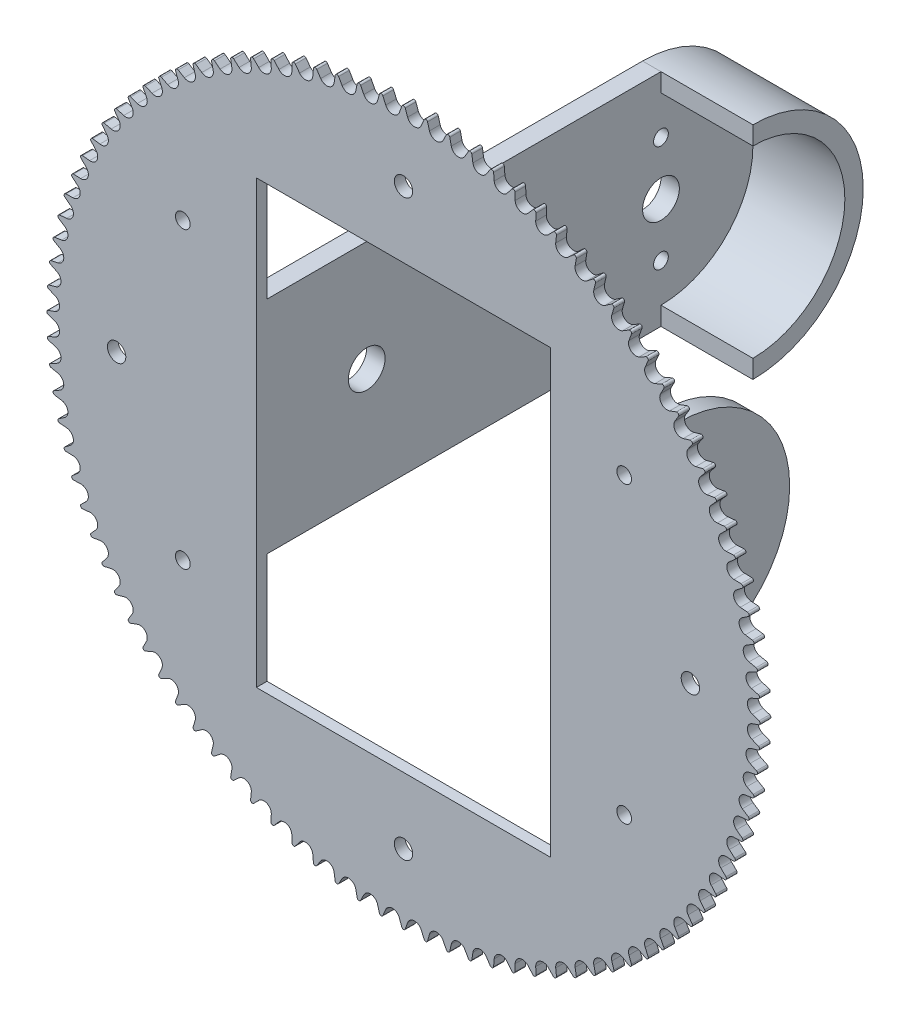
from build123d import *

# Parameters (mm, degrees)
BOSS_EXTRUDE1_DEPTH = 2.9
SKETCH2_R           = 2.5
SKETCH2_W           = 80
SKETCH2_H           = 120
CUT_EXTRUDE1_DEPTH  = 138.201291726
SKETCH3_R           = 2
CUT_EXTRUDE2_DEPTH  = 138.201291726
SKETCH4_R           = 5
BOSS_EXTRUDE2_DEPTH = 5
BOSS_EXTRUDE3_START = -5
SKETCH5_R           = 5
BOSS_EXTRUDE3_DEPTH = 5
EXTRUDE_THIN1_START = 25
EXTRUDE_THIN1_DEPTH = 25


with BuildPart() as part:
    # Sketch1 → Boss-Extrude1 (new body)
    with BuildSketch(Plane.XY):
        with BuildLine():
            ThreePointArc((0.471660482, 96.660230578), (-0.000247578, 96.994289593), (-0.471824584, 96.659763406))
            Line((-0.471824584, 96.659763406), (-1.112701665, 94.832394651))
            ThreePointArc((-1.112701665, 94.832394651), (-2.937212698, 93.495275459), (-4.842040121, 94.715259365))
            Line((-4.842040121, 94.715259365), (-5.598616328, 96.499109499))
            ThreePointArc((-5.598616328, 96.499109499), (-6.090568924, 96.802877973), (-6.540210307, 96.439401332))
            Line((-6.540210307, 96.439401332), (-7.065081331, 94.575397467))
            ThreePointArc((-7.065081331, 94.575397467), (-8.802033699, 93.126354778), (-10.779705804, 94.224326221))
            Line((-10.779705804, 94.224326221), (-11.646797958, 95.957150522))
            ThreePointArc((-11.646797958, 95.957150522), (-12.156853578, 96.229429619), (-12.582784809, 95.838436999))
            Line((-12.582784809, 95.838436999), (-12.989578349, 93.945154396))
            ThreePointArc((-12.989578349, 93.945154396), (-14.632117095, 92.389906921), (-16.674828912, 93.361532709))
            Line((-16.674828912, 93.361532709), (-17.649014996, 95.03649251))
            ThreePointArc((-17.649014996, 95.03649251), (-18.175160684, 95.276207669), (-18.575700808, 94.859242141))
            Line((-18.575700808, 94.859242141), (-18.862811435, 92.944152721))
            ThreePointArc((-18.862811435, 92.944152721), (-20.404454209, 91.28883831), (-22.504144089, 92.13028388))
            Line((-22.504144089, 92.13028388), (-23.581579435, 93.740768881))
            ThreePointArc((-23.581579435, 93.740768881), (-24.121738734, 93.946974056), (-24.495307001, 93.505681191))
            Line((-24.495307001, 93.505681191), (-24.661601622, 91.576342937))
            ThreePointArc((-24.661601622, 91.576342937), (-26.096264264, 89.82749436), (-28.244645691, 90.535438911))
            Line((-28.244645691, 90.535438911), (-29.421078154, 92.075093262))
            ThreePointArc((-29.421078154, 92.075093262), (-29.973119302, 92.246974655), (-30.318241409, 91.783096036))
            Line((-30.318241409, 91.783096036), (-30.363063734, 89.847123164))
            ThreePointArc((-30.363063734, 89.847123164), (-31.685084287, 88.011642328), (-33.87367858, 88.583291927))
            Line((-33.87367858, 88.583291927), (-35.144465319, 90.046039316))
            ThreePointArc((-35.144465319, 90.046039316), (-35.706209662, 90.18291859), (-36.02152357, 89.698284932))
            Line((-36.02152357, 89.698284932), (-35.944696705, 87.763317844))
            ThreePointArc((-35.944696705, 87.763317844), (-37.148857757, 85.848448553), (-39.369027534, 86.281547158))
            Line((-39.369027534, 86.281547158), (-40.729153335, 87.66161479))
            ThreePointArc((-40.729153335, 87.66161479), (-41.298383924, 87.762951745), (-41.582645233, 87.259475677))
            Line((-41.582645233, 87.259475677), (-41.38447238, 85.333150803))
            ThreePointArc((-41.38447238, 85.333150803), (-42.466021658, 83.346450171), (-44.709004923, 83.639288542))
            Line((-44.709004923, 83.639288542), (-46.15310199, 84.93122992))
            ThreePointArc((-46.15310199, 84.93122992), (-46.727572333, 84.996624625), (-46.979659193, 84.476293137))
            Line((-46.979659193, 84.476293137), (-46.660922449, 82.566212802))
            ThreePointArc((-46.660922449, 82.566212802), (-47.615591571, 80.515521428), (-49.872536295, 80.666943865))
            Line((-49.872536295, 80.666943865), (-51.394905436, 81.865660287))
            ThreePointArc((-51.394905436, 81.865660287), (-51.972348361, 81.894854659), (-52.191265901, 81.359721261))
            Line((-52.191265901, 81.359721261), (-51.753223175, 79.473423679))
            ThreePointArc((-51.753223175, 79.473423679), (-52.577244499, 77.366834706), (-54.839243552, 77.376243614))
            Line((-54.839243552, 77.376243614), (-56.433876672, 78.477004293))
            ThreePointArc((-56.433876672, 78.477004293), (-57.012013274, 78.469883116), (-57.196897526, 77.922059735))
            Line((-57.196897526, 77.922059735), (-56.641277572, 76.066989261))
            ThreePointArc((-56.641277572, 76.066989261), (-57.331399063, 73.912816433), (-59.589525367, 73.780174679))
            Line((-59.589525367, 73.780174679), (-61.250129178, 74.778635416))
            ThreePointArc((-61.250129178, 74.778635416), (-61.826677818, 74.735226793), (-61.976799128, 74.176875439))
            Line((-61.976799128, 74.176875439), (-61.305794724, 72.360353188))
            ThreePointArc((-61.305794724, 72.360353188), (-61.859292786, 70.167098041), (-64.10463455, 69.892929101))
            Line((-64.10463455, 69.892929101), (-65.824655407, 70.785149428))
            ThreePointArc((-65.824655407, 70.785149428), (-66.397340709, 70.705624674), (-66.512106618, 70.138948903))
            Line((-66.512106618, 70.138948903), (-65.728365912, 68.368143859))
            ThreePointArc((-65.728365912, 68.368143859), (-66.143056142, 66.14446217), (-68.366752026, 65.729848063))
            Line((-68.366752026, 65.729848063), (-70.139401793, 66.512306794))
            ThreePointArc((-70.139401793, 66.512306794), (-70.705963631, 66.396979756), (-70.78492121, 65.82421598))
            Line((-70.78492121, 65.82421598), (-69.891537268, 64.106116701))
            ThreePointArc((-69.891537268, 64.106116701), (-70.165783074, 61.860784324), (-72.359057167, 61.307361344))
            Line((-72.359057167, 61.307361344), (-74.177340004, 61.976970472))
            ThreePointArc((-74.177340004, 61.976970472), (-74.735542417, 61.826296293), (-74.778380056, 61.249704948))
            Line((-74.778380056, 61.249704948), (-73.778878657, 59.591091987))
            ThreePointArc((-73.778878657, 59.591091987), (-73.911597715, 57.332970225), (-76.065794166, 56.642922479))
            Line((-76.065794166, 56.642922479), (-77.922534143, 57.197039362))
            ThreePointArc((-77.922534143, 57.197039362), (-78.470174161, 57.011612685), (-78.476722799, 56.433469313))
            Line((-78.476722799, 56.433469313), (-77.375048519, 54.840888458))
            ThreePointArc((-77.375048519, 54.840888458), (-77.365717047, 52.578889085), (-79.472334227, 51.754939876))
            Line((-79.472334227, 51.754939876), (-81.360203638, 52.191377669))
            ThreePointArc((-81.360203638, 52.191377669), (-81.895119977, 51.971930287), (-81.86535377, 51.394516557))
            Line((-81.86535377, 51.394516557), (-80.665854413, 49.874252997))
            ThreePointArc((-80.665854413, 49.874252997), (-80.514509239, 47.617303091), (-82.565233292, 46.66270417))
            Line((-82.565233292, 46.66270417), (-84.47678158, 46.979740451))
            ThreePointArc((-84.47678158, 46.979740451), (-84.996863168, 46.727138424), (-84.93089959, 46.152733124))
            Line((-84.93089959, 46.152733124), (-83.638309032, 44.710786645))
            ThreePointArc((-83.638309032, 44.710786645), (-83.345547446, 42.467793355), (-85.332285102, 41.386312089))
            Line((-85.332285102, 41.386312089), (-87.259968259, 41.582695661))
            ThreePointArc((-87.259968259, 41.582695661), (-87.763162572, 41.297935894), (-87.661261951, 40.728805938))
            Line((-87.661261951, 40.728805938), (-86.280681457, 39.370867244))
            ThreePointArc((-86.280681457, 39.370867244), (-85.847658855, 37.150682642), (-87.762569367, 35.946587142))
            Line((-87.762569367, 35.946587142), (-89.698779708, 36.021542969))
            ThreePointArc((-89.698779708, 36.021542969), (-90.183100869, 35.705749277), (-90.04566536, 35.144140763))
            Line((-90.04566536, 35.144140763), (-88.58254345, 33.875569017))
            ThreePointArc((-88.58254345, 33.875569017), (-88.010968774, 31.686955156), (-89.846494866, 30.364997438))
            Line((-89.846494866, 30.364997438), (-91.783591053, 30.318229703))
            ThreePointArc((-91.783591053, 30.318229703), (-92.247127667, 29.972648381), (-92.074699665, 29.42077772))
            Line((-92.074699665, 29.42077772), (-90.534810613, 28.246579395))
            ThreePointArc((-90.534810613, 28.246579395), (-89.826939608, 26.098173734), (-91.575837296, 24.663570961))
            Line((-91.575837296, 24.663570961), (-93.506174497, 24.495264236))
            ThreePointArc((-93.506174497, 24.495264236), (-93.947097196, 24.121259135), (-93.740357196, 23.581304308))
            Line((-93.740357196, 23.581304308), (-92.12977824, 22.506113429))
            ThreePointArc((-92.12977824, 22.506113429), (-91.288404549, 20.406394744), (-92.943771734, 18.864808637))
            Line((-92.943771734, 18.864808637), (-94.859731788, 18.575627152))
            ThreePointArc((-94.859731788, 18.575627152), (-95.276300452, 18.174674299), (-95.036064362, 17.648766261))
            Line((-95.036064362, 17.648766261), (-93.361151722, 16.676826115))
            ThreePointArc((-93.361151722, 16.676826115), (-92.389595863, 14.634081037), (-93.944899567, 12.991595533))
            Line((-93.944899567, 12.991595533), (-95.838921055, 12.582680553))
            ThreePointArc((-95.838921055, 12.582680553), (-96.229491679, 12.156362326), (-95.956707601, 11.646576597))
            Line((-95.956707601, 11.646576597), (-94.224071392, 10.781722988))
            ThreePointArc((-94.224071392, 10.781722988), (-93.126167651, 8.804013298), (-94.5752698, 7.067110536))
            Line((-94.5752698, 7.067110536), (-96.439877886, 6.540075863))
            ThreePointArc((-96.439877886, 6.540075863), (-96.802909065, 6.090074745), (-96.498653553, 5.598423216))
            Line((-96.498653553, 5.598423216), (-94.715131698, 4.844069326))
            ThreePointArc((-94.715131698, 4.844069326), (-93.495213001, 2.93920014), (-94.832394651, 1.114734882))
            Line((-94.832394651, 1.114734882), (-96.660230578, 0.471660482))
            ThreePointArc((-96.660230578, 0.471660482), (-96.994289593, -0.000247578), (-96.659763406, -0.471824584))
            Line((-96.659763406, -0.471824584), (-94.832394651, -1.112701665))
            ThreePointArc((-94.832394651, -1.112701665), (-93.495275459, -2.937212698), (-94.715259365, -4.842040121))
            Line((-94.715259365, -4.842040121), (-96.499109499, -5.598616328))
            ThreePointArc((-96.499109499, -5.598616328), (-96.802877973, -6.090568924), (-96.439401332, -6.540210307))
            Line((-96.439401332, -6.540210307), (-94.575397467, -7.065081331))
            ThreePointArc((-94.575397467, -7.065081331), (-93.126354778, -8.802033699), (-94.224326221, -10.779705804))
            Line((-94.224326221, -10.779705804), (-95.957150522, -11.646797958))
            ThreePointArc((-95.957150522, -11.646797958), (-96.229429619, -12.156853578), (-95.838436999, -12.582784809))
            Line((-95.838436999, -12.582784809), (-93.945154396, -12.989578349))
            ThreePointArc((-93.945154396, -12.989578349), (-92.389906921, -14.632117095), (-93.361532709, -16.674828912))
            Line((-93.361532709, -16.674828912), (-95.03649251, -17.649014996))
            ThreePointArc((-95.03649251, -17.649014996), (-95.276207669, -18.175160684), (-94.859242141, -18.575700808))
            Line((-94.859242141, -18.575700808), (-92.944152721, -18.862811435))
            ThreePointArc((-92.944152721, -18.862811435), (-91.28883831, -20.404454209), (-92.13028388, -22.504144089))
            Line((-92.13028388, -22.504144089), (-93.740768881, -23.581579435))
            ThreePointArc((-93.740768881, -23.581579435), (-93.946974056, -24.121738734), (-93.505681191, -24.495307001))
            Line((-93.505681191, -24.495307001), (-91.576342937, -24.661601622))
            ThreePointArc((-91.576342937, -24.661601622), (-89.82749436, -26.096264264), (-90.535438911, -28.244645691))
            Line((-90.535438911, -28.244645691), (-92.075093262, -29.421078154))
            ThreePointArc((-92.075093262, -29.421078154), (-92.246974655, -29.973119302), (-91.783096036, -30.318241409))
            Line((-91.783096036, -30.318241409), (-89.847123164, -30.363063734))
            ThreePointArc((-89.847123164, -30.363063734), (-88.011642328, -31.685084287), (-88.583291927, -33.87367858))
            Line((-88.583291927, -33.87367858), (-90.046039316, -35.144465319))
            ThreePointArc((-90.046039316, -35.144465319), (-90.18291859, -35.706209662), (-89.698284932, -36.02152357))
            Line((-89.698284932, -36.02152357), (-87.763317844, -35.944696705))
            ThreePointArc((-87.763317844, -35.944696705), (-85.848448553, -37.148857757), (-86.281547158, -39.369027534))
            Line((-86.281547158, -39.369027534), (-87.66161479, -40.729153335))
            ThreePointArc((-87.66161479, -40.729153335), (-87.762951745, -41.298383924), (-87.259475677, -41.582645233))
            Line((-87.259475677, -41.582645233), (-85.333150803, -41.38447238))
            ThreePointArc((-85.333150803, -41.38447238), (-83.346450171, -42.466021658), (-83.639288542, -44.709004923))
            Line((-83.639288542, -44.709004923), (-84.93122992, -46.15310199))
            ThreePointArc((-84.93122992, -46.15310199), (-84.996624625, -46.727572333), (-84.476293137, -46.979659193))
            Line((-84.476293137, -46.979659193), (-82.566212802, -46.660922449))
            ThreePointArc((-82.566212802, -46.660922449), (-80.515521428, -47.615591571), (-80.666943865, -49.872536295))
            Line((-80.666943865, -49.872536295), (-81.865660287, -51.394905436))
            ThreePointArc((-81.865660287, -51.394905436), (-81.894854659, -51.972348361), (-81.359721261, -52.191265901))
            Line((-81.359721261, -52.191265901), (-79.473423679, -51.753223175))
            ThreePointArc((-79.473423679, -51.753223175), (-77.366834706, -52.577244499), (-77.376243614, -54.839243552))
            Line((-77.376243614, -54.839243552), (-78.477004293, -56.433876672))
            ThreePointArc((-78.477004293, -56.433876672), (-78.469883116, -57.012013274), (-77.922059735, -57.196897526))
            Line((-77.922059735, -57.196897526), (-76.066989261, -56.641277572))
            ThreePointArc((-76.066989261, -56.641277572), (-73.912816433, -57.331399063), (-73.780174679, -59.589525367))
            Line((-73.780174679, -59.589525367), (-74.778635416, -61.250129178))
            ThreePointArc((-74.778635416, -61.250129178), (-74.735226793, -61.826677818), (-74.176875439, -61.976799128))
            Line((-74.176875439, -61.976799128), (-72.360353188, -61.305794724))
            ThreePointArc((-72.360353188, -61.305794724), (-70.167098041, -61.859292786), (-69.892929101, -64.10463455))
            Line((-69.892929101, -64.10463455), (-70.785149428, -65.824655407))
            ThreePointArc((-70.785149428, -65.824655407), (-70.705624674, -66.397340709), (-70.138948903, -66.512106618))
            Line((-70.138948903, -66.512106618), (-68.368143859, -65.728365912))
            ThreePointArc((-68.368143859, -65.728365912), (-66.14446217, -66.143056142), (-65.729848063, -68.366752026))
            Line((-65.729848063, -68.366752026), (-66.512306794, -70.139401793))
            ThreePointArc((-66.512306794, -70.139401793), (-66.396979756, -70.705963631), (-65.82421598, -70.78492121))
            Line((-65.82421598, -70.78492121), (-64.106116701, -69.891537268))
            ThreePointArc((-64.106116701, -69.891537268), (-61.860784324, -70.165783074), (-61.307361344, -72.359057167))
            Line((-61.307361344, -72.359057167), (-61.976970472, -74.177340004))
            ThreePointArc((-61.976970472, -74.177340004), (-61.826296293, -74.735542417), (-61.249704948, -74.778380056))
            Line((-61.249704948, -74.778380056), (-59.591091987, -73.778878657))
            ThreePointArc((-59.591091987, -73.778878657), (-57.332970225, -73.911597715), (-56.642922479, -76.065794166))
            Line((-56.642922479, -76.065794166), (-57.197039362, -77.922534143))
            ThreePointArc((-57.197039362, -77.922534143), (-57.011612685, -78.470174161), (-56.433469313, -78.476722799))
            Line((-56.433469313, -78.476722799), (-54.840888458, -77.375048519))
            ThreePointArc((-54.840888458, -77.375048519), (-52.578889085, -77.365717047), (-51.754939876, -79.472334227))
            Line((-51.754939876, -79.472334227), (-52.191377669, -81.360203638))
            ThreePointArc((-52.191377669, -81.360203638), (-51.971930287, -81.895119977), (-51.394516557, -81.86535377))
            Line((-51.394516557, -81.86535377), (-49.874252997, -80.665854413))
            ThreePointArc((-49.874252997, -80.665854413), (-47.617303091, -80.514509239), (-46.66270417, -82.565233292))
            Line((-46.66270417, -82.565233292), (-46.979740451, -84.47678158))
            ThreePointArc((-46.979740451, -84.47678158), (-46.727138424, -84.996863168), (-46.152733124, -84.93089959))
            Line((-46.152733124, -84.93089959), (-44.710786645, -83.638309032))
            ThreePointArc((-44.710786645, -83.638309032), (-42.467793355, -83.345547446), (-41.386312089, -85.332285102))
            Line((-41.386312089, -85.332285102), (-41.582695661, -87.259968259))
            ThreePointArc((-41.582695661, -87.259968259), (-41.297935894, -87.763162572), (-40.728805938, -87.661261951))
            Line((-40.728805938, -87.661261951), (-39.370867244, -86.280681457))
            ThreePointArc((-39.370867244, -86.280681457), (-37.150682642, -85.847658855), (-35.946587142, -87.762569367))
            Line((-35.946587142, -87.762569367), (-36.021542969, -89.698779708))
            ThreePointArc((-36.021542969, -89.698779708), (-35.705749277, -90.183100869), (-35.144140763, -90.04566536))
            Line((-35.144140763, -90.04566536), (-33.875569017, -88.58254345))
            ThreePointArc((-33.875569017, -88.58254345), (-31.686955156, -88.010968774), (-30.364997438, -89.846494866))
            Line((-30.364997438, -89.846494866), (-30.318229703, -91.783591053))
            ThreePointArc((-30.318229703, -91.783591053), (-29.972648381, -92.247127667), (-29.42077772, -92.074699665))
            Line((-29.42077772, -92.074699665), (-28.246579395, -90.534810613))
            ThreePointArc((-28.246579395, -90.534810613), (-26.098173734, -89.826939608), (-24.663570961, -91.575837296))
            Line((-24.663570961, -91.575837296), (-24.495264236, -93.506174497))
            ThreePointArc((-24.495264236, -93.506174497), (-24.121259135, -93.947097196), (-23.581304308, -93.740357196))
            Line((-23.581304308, -93.740357196), (-22.506113429, -92.12977824))
            ThreePointArc((-22.506113429, -92.12977824), (-20.406394744, -91.288404549), (-18.864808637, -92.943771734))
            Line((-18.864808637, -92.943771734), (-18.575627152, -94.859731788))
            ThreePointArc((-18.575627152, -94.859731788), (-18.174674299, -95.276300452), (-17.648766261, -95.036064362))
            Line((-17.648766261, -95.036064362), (-16.676826115, -93.361151722))
            ThreePointArc((-16.676826115, -93.361151722), (-14.634081037, -92.389595863), (-12.991595533, -93.944899567))
            Line((-12.991595533, -93.944899567), (-12.582680553, -95.838921055))
            ThreePointArc((-12.582680553, -95.838921055), (-12.156362326, -96.229491679), (-11.646576597, -95.956707601))
            Line((-11.646576597, -95.956707601), (-10.781722988, -94.224071392))
            ThreePointArc((-10.781722988, -94.224071392), (-8.804013298, -93.126167651), (-7.067110536, -94.5752698))
            Line((-7.067110536, -94.5752698), (-6.540075863, -96.439877886))
            ThreePointArc((-6.540075863, -96.439877886), (-6.090074745, -96.802909065), (-5.598423216, -96.498653553))
            Line((-5.598423216, -96.498653553), (-4.844069326, -94.715131698))
            ThreePointArc((-4.844069326, -94.715131698), (-2.93920014, -93.495213001), (-1.114734882, -94.832394651))
            Line((-1.114734882, -94.832394651), (-0.471660482, -96.660230578))
            ThreePointArc((-0.471660482, -96.660230578), (0.000247578, -96.994289593), (0.471824584, -96.659763406))
            Line((0.471824584, -96.659763406), (1.112701665, -94.832394651))
            ThreePointArc((1.112701665, -94.832394651), (2.937212698, -93.495275459), (4.842040121, -94.715259365))
            Line((4.842040121, -94.715259365), (5.598616328, -96.499109499))
            ThreePointArc((5.598616328, -96.499109499), (6.090568924, -96.802877973), (6.540210307, -96.439401332))
            Line((6.540210307, -96.439401332), (7.065081331, -94.575397467))
            ThreePointArc((7.065081331, -94.575397467), (8.802033699, -93.126354778), (10.779705804, -94.224326221))
            Line((10.779705804, -94.224326221), (11.646797958, -95.957150522))
            ThreePointArc((11.646797958, -95.957150522), (12.156853578, -96.229429619), (12.582784809, -95.838436999))
            Line((12.582784809, -95.838436999), (12.989578349, -93.945154396))
            ThreePointArc((12.989578349, -93.945154396), (14.632117095, -92.389906921), (16.674828912, -93.361532709))
            Line((16.674828912, -93.361532709), (17.649014996, -95.03649251))
            ThreePointArc((17.649014996, -95.03649251), (18.175160684, -95.276207669), (18.575700808, -94.859242141))
            Line((18.575700808, -94.859242141), (18.862811435, -92.944152721))
            ThreePointArc((18.862811435, -92.944152721), (20.404454209, -91.28883831), (22.504144089, -92.13028388))
            Line((22.504144089, -92.13028388), (23.581579435, -93.740768881))
            ThreePointArc((23.581579435, -93.740768881), (24.121738734, -93.946974056), (24.495307001, -93.505681191))
            Line((24.495307001, -93.505681191), (24.661601622, -91.576342937))
            ThreePointArc((24.661601622, -91.576342937), (26.096264264, -89.82749436), (28.244645691, -90.535438911))
            Line((28.244645691, -90.535438911), (29.421078154, -92.075093262))
            ThreePointArc((29.421078154, -92.075093262), (29.973119302, -92.246974655), (30.318241409, -91.783096036))
            Line((30.318241409, -91.783096036), (30.363063734, -89.847123164))
            ThreePointArc((30.363063734, -89.847123164), (31.685084287, -88.011642328), (33.87367858, -88.583291927))
            Line((33.87367858, -88.583291927), (35.144465319, -90.046039316))
            ThreePointArc((35.144465319, -90.046039316), (35.706209662, -90.18291859), (36.02152357, -89.698284932))
            Line((36.02152357, -89.698284932), (35.944696705, -87.763317844))
            ThreePointArc((35.944696705, -87.763317844), (37.148857757, -85.848448553), (39.369027534, -86.281547158))
            Line((39.369027534, -86.281547158), (40.729153335, -87.66161479))
            ThreePointArc((40.729153335, -87.66161479), (41.298383924, -87.762951745), (41.582645233, -87.259475677))
            Line((41.582645233, -87.259475677), (41.38447238, -85.333150803))
            ThreePointArc((41.38447238, -85.333150803), (42.466021658, -83.346450171), (44.709004923, -83.639288542))
            Line((44.709004923, -83.639288542), (46.15310199, -84.93122992))
            ThreePointArc((46.15310199, -84.93122992), (46.727572333, -84.996624625), (46.979659193, -84.476293137))
            Line((46.979659193, -84.476293137), (46.660922449, -82.566212802))
            ThreePointArc((46.660922449, -82.566212802), (47.615591571, -80.515521428), (49.872536295, -80.666943865))
            Line((49.872536295, -80.666943865), (51.394905436, -81.865660287))
            ThreePointArc((51.394905436, -81.865660287), (51.972348361, -81.894854659), (52.191265901, -81.359721261))
            Line((52.191265901, -81.359721261), (51.753223175, -79.473423679))
            ThreePointArc((51.753223175, -79.473423679), (52.577244499, -77.366834706), (54.839243552, -77.376243614))
            Line((54.839243552, -77.376243614), (56.433876672, -78.477004293))
            ThreePointArc((56.433876672, -78.477004293), (57.012013274, -78.469883116), (57.196897526, -77.922059735))
            Line((57.196897526, -77.922059735), (56.641277572, -76.066989261))
            ThreePointArc((56.641277572, -76.066989261), (57.331399063, -73.912816433), (59.589525367, -73.780174679))
            Line((59.589525367, -73.780174679), (61.250129178, -74.778635416))
            ThreePointArc((61.250129178, -74.778635416), (61.826677818, -74.735226793), (61.976799128, -74.176875439))
            Line((61.976799128, -74.176875439), (61.305794724, -72.360353188))
            ThreePointArc((61.305794724, -72.360353188), (61.859292786, -70.167098041), (64.10463455, -69.892929101))
            Line((64.10463455, -69.892929101), (65.824655407, -70.785149428))
            ThreePointArc((65.824655407, -70.785149428), (66.397340709, -70.705624674), (66.512106618, -70.138948903))
            Line((66.512106618, -70.138948903), (65.728365912, -68.368143859))
            ThreePointArc((65.728365912, -68.368143859), (66.143056142, -66.14446217), (68.366752026, -65.729848063))
            Line((68.366752026, -65.729848063), (70.139401793, -66.512306794))
            ThreePointArc((70.139401793, -66.512306794), (70.705963631, -66.396979756), (70.78492121, -65.82421598))
            Line((70.78492121, -65.82421598), (69.891537268, -64.106116701))
            ThreePointArc((69.891537268, -64.106116701), (70.165783074, -61.860784324), (72.359057167, -61.307361344))
            Line((72.359057167, -61.307361344), (74.177340004, -61.976970472))
            ThreePointArc((74.177340004, -61.976970472), (74.735542417, -61.826296293), (74.778380056, -61.249704948))
            Line((74.778380056, -61.249704948), (73.778878657, -59.591091987))
            ThreePointArc((73.778878657, -59.591091987), (73.911597715, -57.332970225), (76.065794166, -56.642922479))
            Line((76.065794166, -56.642922479), (77.922534143, -57.197039362))
            ThreePointArc((77.922534143, -57.197039362), (78.470174161, -57.011612685), (78.476722799, -56.433469313))
            Line((78.476722799, -56.433469313), (77.375048519, -54.840888458))
            ThreePointArc((77.375048519, -54.840888458), (77.365717047, -52.578889085), (79.472334227, -51.754939876))
            Line((79.472334227, -51.754939876), (81.360203638, -52.191377669))
            ThreePointArc((81.360203638, -52.191377669), (81.895119977, -51.971930287), (81.86535377, -51.394516557))
            Line((81.86535377, -51.394516557), (80.665854413, -49.874252997))
            ThreePointArc((80.665854413, -49.874252997), (80.514509239, -47.617303091), (82.565233292, -46.66270417))
            Line((82.565233292, -46.66270417), (84.47678158, -46.979740451))
            ThreePointArc((84.47678158, -46.979740451), (84.996863168, -46.727138424), (84.93089959, -46.152733124))
            Line((84.93089959, -46.152733124), (83.638309032, -44.710786645))
            ThreePointArc((83.638309032, -44.710786645), (83.345547446, -42.467793355), (85.332285102, -41.386312089))
            Line((85.332285102, -41.386312089), (87.259968259, -41.582695661))
            ThreePointArc((87.259968259, -41.582695661), (87.763162572, -41.297935894), (87.661261951, -40.728805938))
            Line((87.661261951, -40.728805938), (86.280681457, -39.370867244))
            ThreePointArc((86.280681457, -39.370867244), (85.847658855, -37.150682642), (87.762569367, -35.946587142))
            Line((87.762569367, -35.946587142), (89.698779708, -36.021542969))
            ThreePointArc((89.698779708, -36.021542969), (90.183100869, -35.705749277), (90.04566536, -35.144140763))
            Line((90.04566536, -35.144140763), (88.58254345, -33.875569017))
            ThreePointArc((88.58254345, -33.875569017), (88.010968774, -31.686955156), (89.846494866, -30.364997438))
            Line((89.846494866, -30.364997438), (91.783591053, -30.318229703))
            ThreePointArc((91.783591053, -30.318229703), (92.247127667, -29.972648381), (92.074699665, -29.42077772))
            Line((92.074699665, -29.42077772), (90.534810613, -28.246579395))
            ThreePointArc((90.534810613, -28.246579395), (89.826939608, -26.098173734), (91.575837296, -24.663570961))
            Line((91.575837296, -24.663570961), (93.506174497, -24.495264236))
            ThreePointArc((93.506174497, -24.495264236), (93.947097196, -24.121259135), (93.740357196, -23.581304308))
            Line((93.740357196, -23.581304308), (92.12977824, -22.506113429))
            ThreePointArc((92.12977824, -22.506113429), (91.288404549, -20.406394744), (92.943771734, -18.864808637))
            Line((92.943771734, -18.864808637), (94.859731788, -18.575627152))
            ThreePointArc((94.859731788, -18.575627152), (95.276300452, -18.174674299), (95.036064362, -17.648766261))
            Line((95.036064362, -17.648766261), (93.361151722, -16.676826115))
            ThreePointArc((93.361151722, -16.676826115), (92.389595863, -14.634081037), (93.944899567, -12.991595533))
            Line((93.944899567, -12.991595533), (95.838921055, -12.582680553))
            ThreePointArc((95.838921055, -12.582680553), (96.229491679, -12.156362326), (95.956707601, -11.646576597))
            Line((95.956707601, -11.646576597), (94.224071392, -10.781722988))
            ThreePointArc((94.224071392, -10.781722988), (93.126167651, -8.804013298), (94.5752698, -7.067110536))
            Line((94.5752698, -7.067110536), (96.439877886, -6.540075863))
            ThreePointArc((96.439877886, -6.540075863), (96.802909065, -6.090074745), (96.498653553, -5.598423216))
            Line((96.498653553, -5.598423216), (94.715131698, -4.844069326))
            ThreePointArc((94.715131698, -4.844069326), (93.495213001, -2.93920014), (94.832394651, -1.114734882))
            Line((94.832394651, -1.114734882), (96.660230578, -0.471660482))
            ThreePointArc((96.660230578, -0.471660482), (96.994289593, 0.000247578), (96.659763406, 0.471824584))
            Line((96.659763406, 0.471824584), (94.832394651, 1.112701665))
            ThreePointArc((94.832394651, 1.112701665), (93.495275459, 2.937212698), (94.715259365, 4.842040121))
            Line((94.715259365, 4.842040121), (96.499109499, 5.598616328))
            ThreePointArc((96.499109499, 5.598616328), (96.802877973, 6.090568924), (96.439401332, 6.540210307))
            Line((96.439401332, 6.540210307), (94.575397467, 7.065081331))
            ThreePointArc((94.575397467, 7.065081331), (93.126354778, 8.802033699), (94.224326221, 10.779705804))
            Line((94.224326221, 10.779705804), (95.957150522, 11.646797958))
            ThreePointArc((95.957150522, 11.646797958), (96.229429619, 12.156853578), (95.838436999, 12.582784809))
            Line((95.838436999, 12.582784809), (93.945154396, 12.989578349))
            ThreePointArc((93.945154396, 12.989578349), (92.389906921, 14.632117095), (93.361532709, 16.674828912))
            Line((93.361532709, 16.674828912), (95.03649251, 17.649014996))
            ThreePointArc((95.03649251, 17.649014996), (95.276207669, 18.175160684), (94.859242141, 18.575700808))
            Line((94.859242141, 18.575700808), (92.944152721, 18.862811435))
            ThreePointArc((92.944152721, 18.862811435), (91.28883831, 20.404454209), (92.13028388, 22.504144089))
            Line((92.13028388, 22.504144089), (93.740768881, 23.581579435))
            ThreePointArc((93.740768881, 23.581579435), (93.946974056, 24.121738734), (93.505681191, 24.495307001))
            Line((93.505681191, 24.495307001), (91.576342937, 24.661601622))
            ThreePointArc((91.576342937, 24.661601622), (89.82749436, 26.096264264), (90.535438911, 28.244645691))
            Line((90.535438911, 28.244645691), (92.075093262, 29.421078154))
            ThreePointArc((92.075093262, 29.421078154), (92.246974655, 29.973119302), (91.783096036, 30.318241409))
            Line((91.783096036, 30.318241409), (89.847123164, 30.363063734))
            ThreePointArc((89.847123164, 30.363063734), (88.011642328, 31.685084287), (88.583291927, 33.87367858))
            Line((88.583291927, 33.87367858), (90.046039316, 35.144465319))
            ThreePointArc((90.046039316, 35.144465319), (90.18291859, 35.706209662), (89.698284932, 36.02152357))
            Line((89.698284932, 36.02152357), (87.763317844, 35.944696705))
            ThreePointArc((87.763317844, 35.944696705), (85.848448553, 37.148857757), (86.281547158, 39.369027534))
            Line((86.281547158, 39.369027534), (87.66161479, 40.729153335))
            ThreePointArc((87.66161479, 40.729153335), (87.762951745, 41.298383924), (87.259475677, 41.582645233))
            Line((87.259475677, 41.582645233), (85.333150803, 41.38447238))
            ThreePointArc((85.333150803, 41.38447238), (83.346450171, 42.466021658), (83.639288542, 44.709004923))
            Line((83.639288542, 44.709004923), (84.93122992, 46.15310199))
            ThreePointArc((84.93122992, 46.15310199), (84.996624625, 46.727572333), (84.476293137, 46.979659193))
            Line((84.476293137, 46.979659193), (82.566212802, 46.660922449))
            ThreePointArc((82.566212802, 46.660922449), (80.515521428, 47.615591571), (80.666943865, 49.872536295))
            Line((80.666943865, 49.872536295), (81.865660287, 51.394905436))
            ThreePointArc((81.865660287, 51.394905436), (81.894854659, 51.972348361), (81.359721261, 52.191265901))
            Line((81.359721261, 52.191265901), (79.473423679, 51.753223175))
            ThreePointArc((79.473423679, 51.753223175), (77.366834706, 52.577244499), (77.376243614, 54.839243552))
            Line((77.376243614, 54.839243552), (78.477004293, 56.433876672))
            ThreePointArc((78.477004293, 56.433876672), (78.469883116, 57.012013274), (77.922059735, 57.196897526))
            Line((77.922059735, 57.196897526), (76.066989261, 56.641277572))
            ThreePointArc((76.066989261, 56.641277572), (73.912816433, 57.331399063), (73.780174679, 59.589525367))
            Line((73.780174679, 59.589525367), (74.778635416, 61.250129178))
            ThreePointArc((74.778635416, 61.250129178), (74.735226793, 61.826677818), (74.176875439, 61.976799128))
            Line((74.176875439, 61.976799128), (72.360353188, 61.305794724))
            ThreePointArc((72.360353188, 61.305794724), (70.167098041, 61.859292786), (69.892929101, 64.10463455))
            Line((69.892929101, 64.10463455), (70.785149428, 65.824655407))
            ThreePointArc((70.785149428, 65.824655407), (70.705624674, 66.397340709), (70.138948903, 66.512106618))
            Line((70.138948903, 66.512106618), (68.368143859, 65.728365912))
            ThreePointArc((68.368143859, 65.728365912), (66.14446217, 66.143056142), (65.729848063, 68.366752026))
            Line((65.729848063, 68.366752026), (66.512306794, 70.139401793))
            ThreePointArc((66.512306794, 70.139401793), (66.396979756, 70.705963631), (65.82421598, 70.78492121))
            Line((65.82421598, 70.78492121), (64.106116701, 69.891537268))
            ThreePointArc((64.106116701, 69.891537268), (61.860784324, 70.165783074), (61.307361344, 72.359057167))
            Line((61.307361344, 72.359057167), (61.976970472, 74.177340004))
            ThreePointArc((61.976970472, 74.177340004), (61.826296293, 74.735542417), (61.249704948, 74.778380056))
            Line((61.249704948, 74.778380056), (59.591091987, 73.778878657))
            ThreePointArc((59.591091987, 73.778878657), (57.332970225, 73.911597715), (56.642922479, 76.065794166))
            Line((56.642922479, 76.065794166), (57.197039362, 77.922534143))
            ThreePointArc((57.197039362, 77.922534143), (57.011612685, 78.470174161), (56.433469313, 78.476722799))
            Line((56.433469313, 78.476722799), (54.840888458, 77.375048519))
            ThreePointArc((54.840888458, 77.375048519), (52.578889085, 77.365717047), (51.754939876, 79.472334227))
            Line((51.754939876, 79.472334227), (52.191377669, 81.360203638))
            ThreePointArc((52.191377669, 81.360203638), (51.971930287, 81.895119977), (51.394516557, 81.86535377))
            Line((51.394516557, 81.86535377), (49.874252997, 80.665854413))
            ThreePointArc((49.874252997, 80.665854413), (47.617303091, 80.514509239), (46.66270417, 82.565233292))
            Line((46.66270417, 82.565233292), (46.979740451, 84.47678158))
            ThreePointArc((46.979740451, 84.47678158), (46.727138424, 84.996863168), (46.152733124, 84.93089959))
            Line((46.152733124, 84.93089959), (44.710786645, 83.638309032))
            ThreePointArc((44.710786645, 83.638309032), (42.467793355, 83.345547446), (41.386312089, 85.332285102))
            Line((41.386312089, 85.332285102), (41.582695661, 87.259968259))
            ThreePointArc((41.582695661, 87.259968259), (41.297935894, 87.763162572), (40.728805938, 87.661261951))
            Line((40.728805938, 87.661261951), (39.370867244, 86.280681457))
            ThreePointArc((39.370867244, 86.280681457), (37.150682642, 85.847658855), (35.946587142, 87.762569367))
            Line((35.946587142, 87.762569367), (36.021542969, 89.698779708))
            ThreePointArc((36.021542969, 89.698779708), (35.705749277, 90.183100869), (35.144140763, 90.04566536))
            Line((35.144140763, 90.04566536), (33.875569017, 88.58254345))
            ThreePointArc((33.875569017, 88.58254345), (31.686955156, 88.010968774), (30.364997438, 89.846494866))
            Line((30.364997438, 89.846494866), (30.318229703, 91.783591053))
            ThreePointArc((30.318229703, 91.783591053), (29.972648381, 92.247127667), (29.42077772, 92.074699665))
            Line((29.42077772, 92.074699665), (28.246579395, 90.534810613))
            ThreePointArc((28.246579395, 90.534810613), (26.098173734, 89.826939608), (24.663570961, 91.575837296))
            Line((24.663570961, 91.575837296), (24.495264236, 93.506174497))
            ThreePointArc((24.495264236, 93.506174497), (24.121259135, 93.947097196), (23.581304308, 93.740357196))
            Line((23.581304308, 93.740357196), (22.506113429, 92.12977824))
            ThreePointArc((22.506113429, 92.12977824), (20.406394744, 91.288404549), (18.864808637, 92.943771734))
            Line((18.864808637, 92.943771734), (18.575627152, 94.859731788))
            ThreePointArc((18.575627152, 94.859731788), (18.174674299, 95.276300452), (17.648766261, 95.036064362))
            Line((17.648766261, 95.036064362), (16.676826115, 93.361151722))
            ThreePointArc((16.676826115, 93.361151722), (14.634081037, 92.389595863), (12.991595533, 93.944899567))
            Line((12.991595533, 93.944899567), (12.582680553, 95.838921055))
            ThreePointArc((12.582680553, 95.838921055), (12.156362326, 96.229491679), (11.646576597, 95.956707601))
            Line((11.646576597, 95.956707601), (10.781722988, 94.224071392))
            ThreePointArc((10.781722988, 94.224071392), (8.804013298, 93.126167651), (7.067110536, 94.5752698))
            Line((7.067110536, 94.5752698), (6.540075863, 96.439877886))
            ThreePointArc((6.540075863, 96.439877886), (6.090074745, 96.802909065), (5.598423216, 96.498653553))
            Line((5.598423216, 96.498653553), (4.844069326, 94.715131698))
            ThreePointArc((4.844069326, 94.715131698), (2.93920014, 93.495213001), (1.114734882, 94.832394651))
            Line((1.114734882, 94.832394651), (0.471660482, 96.660230578))
        make_face()
    extrude(amount=BOSS_EXTRUDE1_DEPTH)

    # Sketch2 → Cut-Extrude1 (cut, through all)
    with BuildSketch(Plane.XY.offset(2.9)):
        with Locations((0, 78)):
            Circle(SKETCH2_R)
        with Locations((78, 0)):
            Circle(SKETCH2_R)
        with Locations((0, -78)):
            Circle(SKETCH2_R)
        with Locations((-78, 0)):
            Circle(SKETCH2_R)
        Rectangle(SKETCH2_W, SKETCH2_H)
    extrude(amount=-CUT_EXTRUDE1_DEPTH, mode=Mode.SUBTRACT)

    # Sketch3 → Cut-Extrude2 (cut, through all)
    with BuildSketch(Plane(origin=(0, 0, 0), x_dir=(-1, 0, 0), z_dir=(0, 0, -1))):
        with Locations((60, -40)):
            Circle(SKETCH3_R)
        with Locations((-60, -40)):
            Circle(SKETCH3_R)
        with Locations((-60, 40)):
            Circle(SKETCH3_R)
        with Locations((60, 40)):
            Circle(SKETCH3_R)
    extrude(amount=-CUT_EXTRUDE2_DEPTH, mode=Mode.SUBTRACT)

    # Sketch4 → Boss-Extrude2 (add)
    with BuildSketch(Plane(origin=(-40, 0, 0), x_dir=(0, 0, -1), z_dir=(1, 0, 0))):
        with BuildLine():
            Line((107.1, 30), (0, 30))
            Line((0, 30), (0, -30))
            Line((0, -30), (107.1, -30))
            ThreePointArc((107.1, -30), (137.1, 0), (107.1, 30))
        make_face()
        with Locations((27.1, 0)):
            Circle(SKETCH4_R, mode=Mode.SUBTRACT)
        with BuildLine():
            ThreePointArc((109.1, -14.5), (105.685786438, -15.914213562), (107.1, -12.5))
            ThreePointArc((107.1, -12.5), (108.514213562, -13.085786438), (109.1, -14.5))
        make_face(mode=Mode.SUBTRACT)
        with BuildLine():
            ThreePointArc((107.1, -5), (102.1, 0), (107.1, 5))
            ThreePointArc((107.1, 5), (110.635533906, 3.535533906), (112.1, 0))
            ThreePointArc((112.1, 0), (110.635533906, -3.535533906), (107.1, -5))
        make_face(mode=Mode.SUBTRACT)
        with BuildLine():
            ThreePointArc((109.1, 14.5), (108.514213562, 13.085786438), (107.1, 12.5))
            ThreePointArc((107.1, 12.5), (105.685786438, 15.914213562), (109.1, 14.5))
        make_face(mode=Mode.SUBTRACT)
    extrude(amount=-BOSS_EXTRUDE2_DEPTH)

    # Sketch5 → Boss-Extrude3 (add)
    with BuildSketch(Plane.ZY.offset(-40).offset(BOSS_EXTRUDE3_START)):
        with BuildLine():
            Line((-27.1, 30), (2.9, 30))
            Line((2.9, 30), (2.9, -30))
            Line((2.9, -30), (-27.1, -30))
            ThreePointArc((-27.1, -30), (-57.1, 0), (-27.1, 30))
        make_face()
        with Locations((-27.1, 0)):
            Circle(SKETCH5_R, mode=Mode.SUBTRACT)
    extrude(amount=BOSS_EXTRUDE3_DEPTH)

    # Sketch6 → Extrude-Thin1 (add)
    with BuildSketch(Plane(origin=(-40, 0, 0), x_dir=(0, 0, -1), z_dir=(1, 0, 0)).offset(EXTRUDE_THIN1_START)):
        with BuildLine():
            ThreePointArc((107.1, -30), (137.1, 0), (107.1, 30))
            Line((107.1, 30), (107.1, 25))
            ThreePointArc((107.1, 25), (132.1, 0), (107.1, -25))
            Line((107.1, -25), (107.1, -30))
        make_face()
    extrude(amount=-EXTRUDE_THIN1_DEPTH)


solid = part.part
